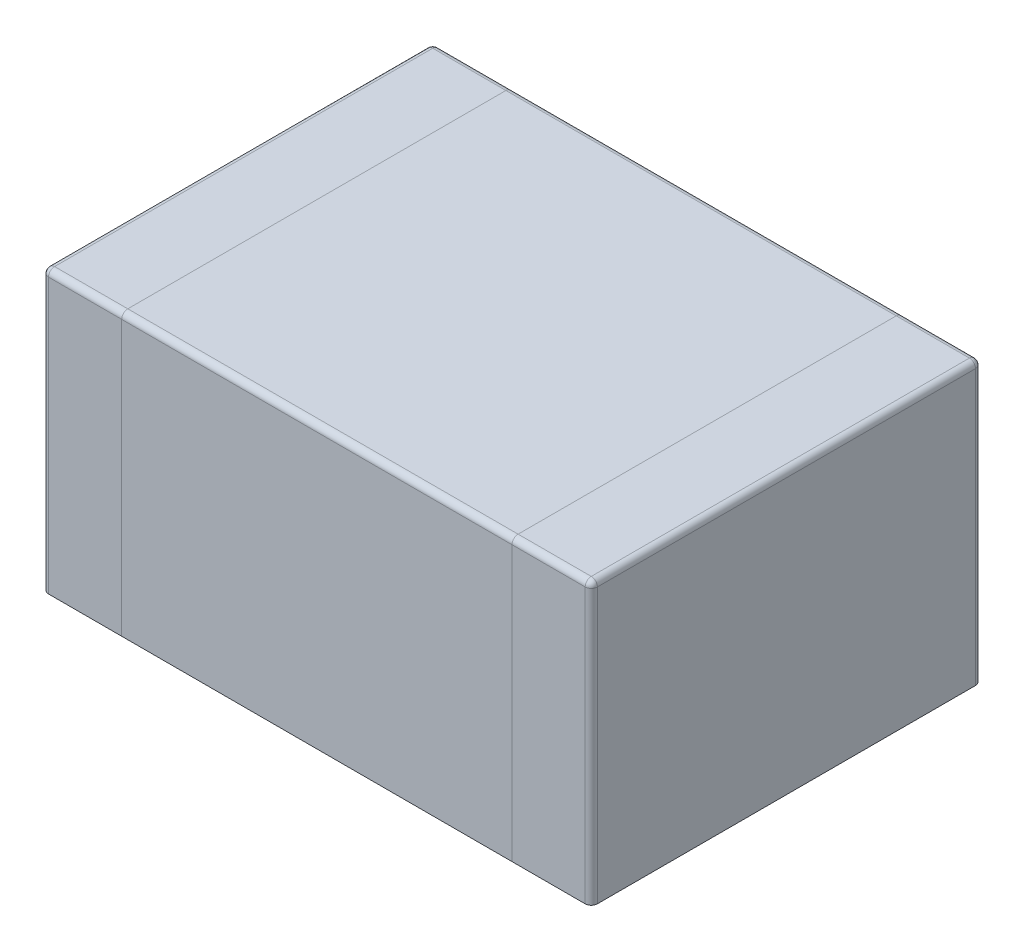
from build123d import *

# Parameters (mm, degrees)
CROQUIS1_W                = 0.65
CROQUIS1_H                = 3.2
SALIENTE_EXTRUIR1_DEPTH   = 2.3
SALIENTE_EXTRUIR1_2_DEPTH = 2.3
CROQUIS2_W                = 3.2
CROQUIS2_H                = 3.2
SALIENTE_EXTRUIR2_DEPTH   = 2.3
REDONDEO1_R               = 0.05
REDONDEO2_R               = 0.05
REDONDEO3_R               = 0.05
REDONDEO4_R               = 0.05


with BuildPart() as part:
    # Croquis1 → Saliente-Extruir1 (new body)
    with BuildSketch(Plane(origin=(0, 0, 0), x_dir=(1, 0, 0), z_dir=(0, 1, 0))):
        with Locations((-1.925, 0)):
            Rectangle(CROQUIS1_W, CROQUIS1_H)
    extrude(amount=SALIENTE_EXTRUIR1_DEPTH)

    # Redondeo1
    redondeo1_edges = [part.edges().sort_by_distance(p)[0] for p in [
        (-2.25, 2.3, 0),
        (-1.925, 2.3, 1.6),
        (-1.925, 2.3, -1.6),
    ]]
    fillet(redondeo1_edges, radius=REDONDEO1_R)

    # Redondeo4
    # the kernel refuses this fillet: 0.05 mm, written as the material it takes off along each edge
    with BuildSketch(Plane(origin=(-2.2, 2.25, 1.55), x_dir=(-1, 0, 0), z_dir=(0, 0, 1))) as redondeo4_piece_1_section:
        Polygon((0, 0), (REDONDEO4_R, 0), (REDONDEO4_R, -REDONDEO4_R), (0, -REDONDEO4_R), align=None)
    redondeo4_piece_1 = extrude(amount=REDONDEO4_R, mode=Mode.PRIVATE)
    redondeo4_piece_1 = redondeo4_piece_1 - Plane(origin=(-2.2, 2.25, 1.55), x_dir=(0.7071067811865475, -0.7071067811865475, 0), z_dir=(0, 0, 1)) * Sphere(REDONDEO4_R, mode=Mode.PRIVATE)
    add(redondeo4_piece_1, mode=Mode.SUBTRACT)
    with BuildSketch(Plane(origin=(-2.2, 2.25, -1.55), x_dir=(0, 0, -1), z_dir=(-1, 0, 0))) as redondeo4_piece_2_section:
        Polygon((0, 0), (REDONDEO4_R, 0), (REDONDEO4_R, -REDONDEO4_R), (0, -REDONDEO4_R), align=None)
    redondeo4_piece_2 = extrude(amount=REDONDEO4_R, mode=Mode.PRIVATE)
    redondeo4_piece_2 = redondeo4_piece_2 - Plane(origin=(-2.2, 2.25, -1.55), x_dir=(0, -0.7071067811865475, 0.7071067811865475), z_dir=(-1, 0, 0)) * Sphere(REDONDEO4_R, mode=Mode.PRIVATE)
    add(redondeo4_piece_2, mode=Mode.SUBTRACT)
    with BuildSketch(Plane(origin=(-2.25, -0.125, -1.6), x_dir=(0, 0, 1), z_dir=(0, 1, 0)), Plane(origin=(-2.25, -0.125, 1.6), x_dir=(1, 0, 0), z_dir=(0, 1, 0))) as redondeo4_piece_3:
        with BuildLine():
            CenterArc((REDONDEO4_R, REDONDEO4_R), REDONDEO4_R, 180, 90)
            Line((0, REDONDEO4_R), (0, 0))
            Line((0, 0), (REDONDEO4_R, 0))
        make_face()
    extrude(amount=2.375, mode=Mode.SUBTRACT)


with BuildPart() as body_2:
    # Croquis1 → Saliente-Extruir1 2 (new body)
    with BuildSketch(Plane(origin=(0, 0, 0), x_dir=(1, 0, 0), z_dir=(0, 1, 0))):
        with Locations((1.925, 0)):
            Rectangle(CROQUIS1_W, CROQUIS1_H)
    extrude(amount=SALIENTE_EXTRUIR1_2_DEPTH)

    # Redondeo3
    redondeo3_edges = [body_2.edges().sort_by_distance(p)[0] for p in [
        (1.925, 2.3, 1.6),
        (2.25, 2.3, 0),
        (1.925, 2.3, -1.6),
        (2.25, 1.15, -1.6),
        (2.25, 1.15, 1.6),
    ]]
    fillet(redondeo3_edges, radius=REDONDEO3_R)


with BuildPart() as body_3:
    # Croquis2 → Saliente-Extruir2 (new, through all)
    with BuildSketch(Plane(origin=(0, 2.3, 0), x_dir=(1, 0, 0), z_dir=(0, 1, 0))):
        Rectangle(CROQUIS2_W, CROQUIS2_H)
    extrude(amount=-SALIENTE_EXTRUIR2_DEPTH)

    # Redondeo2
    redondeo2_edges = [body_3.edges().sort_by_distance(p)[0] for p in [
        (0, 2.3, -1.6),
        (0, 2.3, 1.6),
    ]]
    fillet(redondeo2_edges, radius=REDONDEO2_R)


solid = Compound([part.part, body_2.part, body_3.part])
